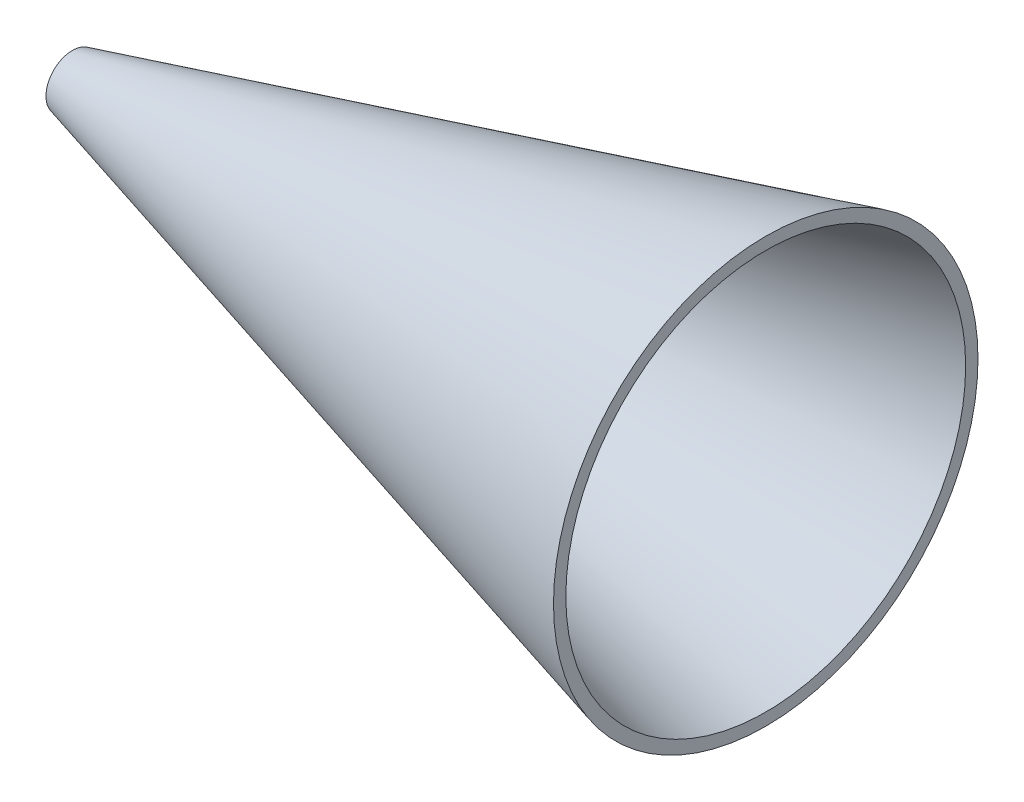
from build123d import *


with BuildPart() as part:
    # Schizzo1 → Rivoluzione1 (revolve)
    with BuildSketch(Plane.XY):
        Polygon((-13.83497223, 5.9), (277.16502777, 83.9), (277.16502777, 89.076500036), (-13.83497223, 11.076500036), align=None)
    revolve(axis=Axis((-77.401834861, 0, 0), (1, 0, 0)))


solid = part.part
